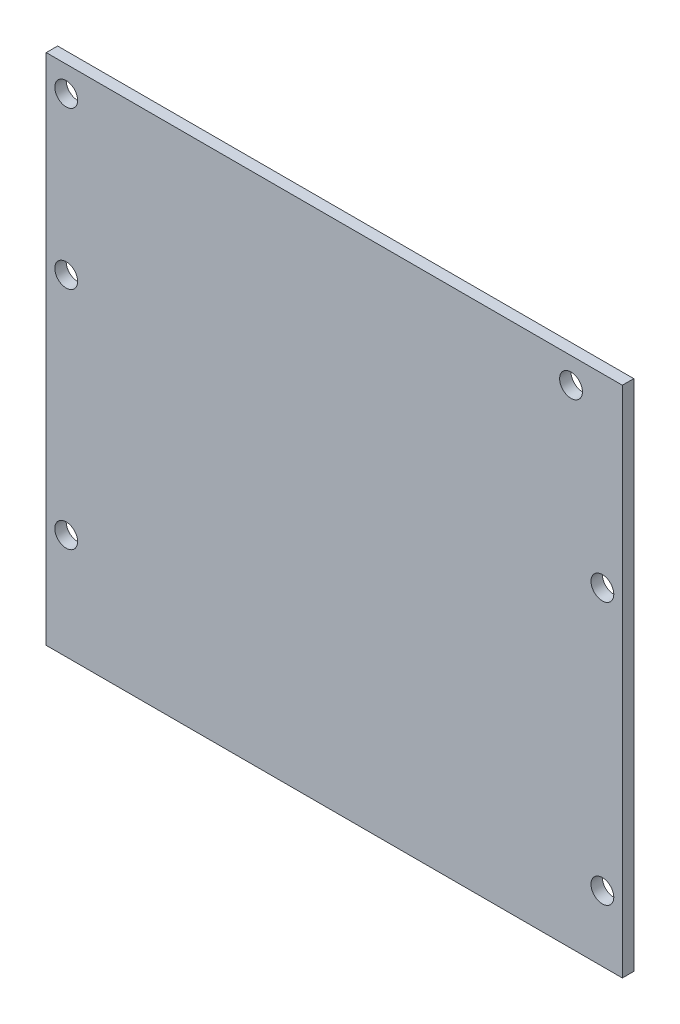
from build123d import *

# Parameters (mm, degrees)
ESQUISSE1_W             = 101
ESQUISSE1_H             = 90
BOSS_EXTRU_1_DEPTH      = 2
HOLE_SKETCH_R           = 2
ENL_V_MAT_EXTRU_1_DEPTH = 136.295971854


with BuildPart() as part:
    # Esquisse1 → Boss.-Extru.1 (new body)
    with BuildSketch(Plane.XY):
        with Locations((50.5, 45)):
            Rectangle(ESQUISSE1_W, ESQUISSE1_H)
    extrude(amount=BOSS_EXTRU_1_DEPTH)

    # Hole Sketch → Enlèv. mat.-Extru.1 (cut, through all)
    with BuildSketch(Plane.XY.offset(2)):
        with Locations((97.5, 11.5)):
            Circle(HOLE_SKETCH_R)
        with Locations((97.5, 57.5)):
            Circle(HOLE_SKETCH_R)
        with Locations((3.5, 18.5)):
            Circle(HOLE_SKETCH_R)
        with Locations((3.5, 58)):
            Circle(HOLE_SKETCH_R)
        with Locations((3.5, 85.5)):
            Circle(HOLE_SKETCH_R)
        with Locations((92, 85.5)):
            Circle(HOLE_SKETCH_R)
    extrude(amount=-ENL_V_MAT_EXTRU_1_DEPTH, mode=Mode.SUBTRACT)


solid = part.part
